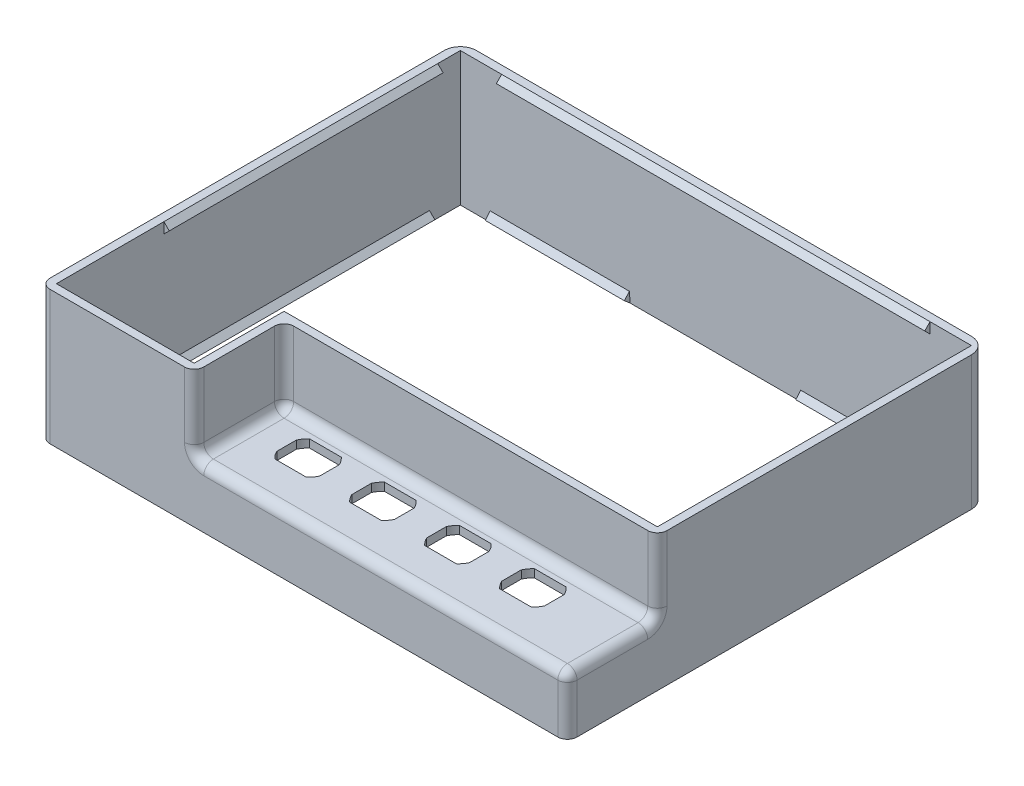
from build123d import *

# Parameters (mm, degrees)
SKETCH1_W                 = 98.44
SKETCH1_H                 = 78.44
SKETCH1_W_2               = 95.44
SKETCH1_H_2               = 75.44
BOSS_EXTRUDE1_DEPTH       = 25
SKETCH4_W                 = 98.44
SKETCH4_H                 = 16.8
BOSS_EXTRUDE2_DEPTH       = 1.5
CUT_EXTRUDE1_DEPTH        = 1.6
SKETCH5_W                 = 18
SKETCH5_H                 = 14
CUT_EXTRUDE2_DEPTH        = 70.5
BOSS_EXTRUDE9_DEPTH       = 49.22
BOSS_EXTRUDE9_DEPTH_BACK  = 22
SKETCH7_W                 = 1.5
SKETCH7_H                 = 15.5
BOSS_EXTRUDE10_START      = -56
BOSS_EXTRUDE10_DEPTH      = 64
BOSS_EXTRUDE11_DEPTH      = 42
BOSS_EXTRUDE11_DEPTH_BACK = 42
CUT_EXTRUDE3_DEPTH        = 16
CUT_EXTRUDE3_DEPTH_BACK   = 16
BOSS_EXTRUDE12_DEPTH      = 42
BOSS_EXTRUDE12_DEPTH_BACK = 42
CUT_EXTRUDE4_DEPTH        = 16
CUT_EXTRUDE4_DEPTH_BACK   = 16
BOSS_EXTRUDE13_DEPTH      = 40
BOSS_EXTRUDE13_DEPTH_BACK = 40
BOSS_EXTRUDE14_START      = -15.64
BOSS_EXTRUDE14_DEPTH      = 51.14
FILLET4_R                 = 1.8
SKETCH16_W                = 1.5
SKETCH16_H                = 14
BOSS_EXTRUDE15_DEPTH      = 16.8
SKETCH17_W                = 15.3
SKETCH17_H                = 1.5
CUT_EXTRUDE6_DEPTH        = 25.72
FILLET5_R                 = 1.8
BOSS_EXTRUDE16_DEPTH      = 53
FILLET6_R                 = 3


with BuildPart() as part:
    # Sketch1 → Boss-Extrude1 (new body)
    with BuildSketch(Plane(origin=(0, 0, 0), x_dir=(1, 0, 0), z_dir=(0, 1, 0))):
        Rectangle(SKETCH1_W, SKETCH1_H)
        Rectangle(SKETCH1_W_2, SKETCH1_H_2, mode=Mode.SUBTRACT)
    extrude(amount=BOSS_EXTRUDE1_DEPTH)

    # Sketch4 → Boss-Extrude2 (add)
    with BuildSketch(Plane(origin=(0, 11, 0), x_dir=(-1, 0, 0), z_dir=(0, -1, 0))):
        with Locations((0, -30.82)):
            Rectangle(SKETCH4_W, SKETCH4_H)
    extrude(amount=BOSS_EXTRUDE2_DEPTH)

    # Sketch3 → Cut-Extrude1 (cut)
    with BuildSketch(Plane(origin=(0, 11, 0), x_dir=(-1, 0, 0), z_dir=(0, -1, 0))):
        with BuildLine():
            Line((-34.933489157, -25.17), (-29.010238143, -25.17))
            ThreePointArc((-29.010238143, -25.17), (-28.418962197, -25.829514156), (-27.97186365, -26.594150707))
            Line((-27.97186365, -26.594150707), (-27.97186365, -30.245849293))
            ThreePointArc((-27.97186365, -30.245849293), (-28.418962197, -31.010485844), (-29.010238143, -31.67))
            Line((-29.010238143, -31.67), (-34.933489157, -31.67))
            ThreePointArc((-34.933489157, -31.67), (-35.524765103, -31.010485844), (-35.97186365, -30.245849293))
            Line((-35.97186365, -30.245849293), (-35.97186365, -26.594150707))
            ThreePointArc((-35.97186365, -26.594150707), (-35.524765103, -25.829514156), (-34.933489157, -25.17))
        make_face()
        with BuildLine():
            Line((-20.933489157, -25.17), (-15.010238143, -25.17))
            ThreePointArc((-15.010238143, -25.17), (-14.418962197, -25.829514156), (-13.97186365, -26.594150707))
            Line((-13.97186365, -26.594150707), (-13.97186365, -30.245849293))
            ThreePointArc((-13.97186365, -30.245849293), (-14.418962197, -31.010485844), (-15.010238143, -31.67))
            Line((-15.010238143, -31.67), (-20.933489157, -31.67))
            ThreePointArc((-20.933489157, -31.67), (-21.524765103, -31.010485844), (-21.97186365, -30.245849293))
            Line((-21.97186365, -30.245849293), (-21.97186365, -26.594150707))
            ThreePointArc((-21.97186365, -26.594150707), (-21.524765103, -25.829514156), (-20.933489157, -25.17))
        make_face()
        with BuildLine():
            Line((-6.933489157, -25.17), (-1.010238143, -25.17))
            ThreePointArc((-1.010238143, -25.17), (-0.418962197, -25.829514156), (0.02813635, -26.594150707))
            Line((0.02813635, -26.594150707), (0.02813635, -30.245849293))
            ThreePointArc((0.02813635, -30.245849293), (-0.418962197, -31.010485844), (-1.010238143, -31.67))
            Line((-1.010238143, -31.67), (-6.933489157, -31.67))
            ThreePointArc((-6.933489157, -31.67), (-7.524765103, -31.010485844), (-7.97186365, -30.245849293))
            Line((-7.97186365, -30.245849293), (-7.97186365, -26.594150707))
            ThreePointArc((-7.97186365, -26.594150707), (-7.524765103, -25.829514156), (-6.933489157, -25.17))
        make_face()
        with BuildLine():
            Line((7.066510843, -25.17), (12.989761857, -25.17))
            ThreePointArc((12.989761857, -25.17), (13.581037803, -25.829514156), (14.02813635, -26.594150707))
            Line((14.02813635, -26.594150707), (14.02813635, -30.245849293))
            ThreePointArc((14.02813635, -30.245849293), (13.581037803, -31.010485844), (12.989761857, -31.67))
            Line((12.989761857, -31.67), (7.066510843, -31.67))
            ThreePointArc((7.066510843, -31.67), (6.475234897, -31.010485844), (6.02813635, -30.245849293))
            Line((6.02813635, -30.245849293), (6.02813635, -26.594150707))
            ThreePointArc((6.02813635, -26.594150707), (6.475234897, -25.829514156), (7.066510843, -25.17))
        make_face()
    extrude(amount=CUT_EXTRUDE1_DEPTH, mode=Mode.SUBTRACT)

    # Sketch5 → Cut-Extrude2 (cut)
    with BuildSketch(Plane(origin=(49.22, 0, 0), x_dir=(0, 0, -1), z_dir=(1, 0, 0))):
        with Locations((-30.22, 18)):
            Rectangle(SKETCH5_W, SKETCH5_H)
    extrude(amount=-CUT_EXTRUDE2_DEPTH, mode=Mode.SUBTRACT)

    # Sketch7 → Boss-Extrude9 (add, two sides: drawn at the far end of the back side and taken through both)
    with BuildSketch(Plane(origin=(0, 0, 0), x_dir=(0, 0, -1), z_dir=(1, 0, 0)).offset(-BOSS_EXTRUDE9_DEPTH_BACK)):
        with Locations((-21.67, 17.25)):
            Rectangle(SKETCH7_W, SKETCH7_H)
    extrude(amount=BOSS_EXTRUDE9_DEPTH + BOSS_EXTRUDE9_DEPTH_BACK)

    # Sketch9 → Boss-Extrude10 (add)
    with BuildSketch(Plane.XY.offset(24.04).offset(BOSS_EXTRUDE10_START)):
        Polygon((-47.72, 2), (-46.72, 1), (-47.72, 0), align=None)
    boss_extrude10 = extrude(amount=BOSS_EXTRUDE10_DEPTH)

    # Mirror1: Boss-Extrude10 across plane
    add(boss_extrude10.mirror(Plane(origin=(0, 0, 0), x_dir=(0, 0, 1), z_dir=(1, 0, 0))))

    # Sketch12 → Boss-Extrude13 (add, two sides: drawn at the far end of the back side and taken through both)
    with BuildSketch(Plane(origin=(0, 0, 0), x_dir=(0, 0, -1), z_dir=(1, 0, 0)).offset(-BOSS_EXTRUDE13_DEPTH_BACK)):
        Polygon((36.72, 24), (37.72, 25), (37.72, 23), align=None)
    extrude(amount=BOSS_EXTRUDE13_DEPTH + BOSS_EXTRUDE13_DEPTH_BACK)

    # Sketch14 → Boss-Extrude14 (add)
    with BuildSketch(Plane.XY.offset(-17.86).offset(BOSS_EXTRUDE14_START)):
        Polygon((47.72, 25), (46.72, 24), (47.72, 23), align=None)
    boss_extrude14 = extrude(amount=BOSS_EXTRUDE14_DEPTH)

    # Mirror3: Boss-Extrude14 across plane
    add(boss_extrude14.mirror(Plane(origin=(0, 0, 0), x_dir=(0, 0, 1), z_dir=(1, 0, 0))))

    # Fillet4
    fillet4_edges = [part.edges().sort_by_distance(p)[0] for p in [
        (49.22, 5.5, 39.22),
        (49.22, 11, 30.82),
        (13.61, 11, 22.42),
        (49.22, 18, 22.42),
        (-49.22, 12.5, 39.22),
    ]]
    fillet(fillet4_edges, radius=FILLET4_R)

    # Sketch16 → Boss-Extrude15 (add)
    with BuildSketch(Plane.XY.offset(22.42)):
        with Locations((-21.25, 18)):
            Rectangle(SKETCH16_W, SKETCH16_H)
    extrude(amount=BOSS_EXTRUDE15_DEPTH)

    # Sketch17 → Cut-Extrude6 (cut)
    with BuildSketch(Plane(origin=(-47.72, 0, 0), x_dir=(0, 0, -1), z_dir=(1, 0, 0))):
        with Locations((-30.07, 10.25)):
            Rectangle(SKETCH17_W, SKETCH17_H)
    extrude(amount=CUT_EXTRUDE6_DEPTH, mode=Mode.SUBTRACT)

    # Fillet5
    # the kernel refuses this fillet: 1.8 mm, written as the material it adds along each edge
    with BuildSketch(Plane(origin=(-20.5, 12.8, 24.22), x_dir=(0, 0, -1), z_dir=(0, 1, 0))) as fillet5_piece_1:
        with BuildLine():
            CenterArc((1.8 - FILLET5_R, -FILLET5_R), FILLET5_R, 0, 90)
            Line((1.8 - FILLET5_R, 0), (1.8, 0))
            Line((1.8, 0), (1.8, -FILLET5_R))
        make_face()
    revolve(axis=Axis((-20.5, 12.8, 24.22), (-1, 0, 0)), revolution_arc=90)
    with BuildSketch(Plane(origin=(-20.5, 11, 24.22), x_dir=(1, 0, 0), z_dir=(0, 0, 1))) as fillet5_piece_2:
        with BuildLine():
            CenterArc((FILLET5_R, FILLET5_R), FILLET5_R, 180, 90)
            Line((0, FILLET5_R), (0, 0))
            Line((0, 0), (FILLET5_R, 0))
        make_face()
    extrude(amount=15)
    with BuildSketch(Plane(origin=(-20.5, 25, 22.42), x_dir=(1, 0, 0), z_dir=(0, -1, 0))) as fillet5_piece_3:
        with BuildLine():
            CenterArc((FILLET5_R, FILLET5_R), FILLET5_R, 180, 90)
            Line((0, FILLET5_R), (0, 0))
            Line((0, 0), (FILLET5_R, 0))
        make_face()
    extrude(amount=12.2)
    # the kernel refuses this fillet: 1.8 mm, written as the material it takes off along each edge
    with BuildSketch(Plane(origin=(47.42, 9.2, 37.42), x_dir=(0, 1, 0), z_dir=(0, 0, 1))) as fillet5_2_piece_1_section:
        Polygon((0, 0), (FILLET5_R, 0), (FILLET5_R, -FILLET5_R), (0, -FILLET5_R), align=None)
    fillet5_2_piece_1 = extrude(amount=FILLET5_R, mode=Mode.PRIVATE)
    fillet5_2_piece_1 = fillet5_2_piece_1 - Plane(origin=(47.42, 9.2, 37.42), x_dir=(-0.7071067811865475, -0.7071067811865475, 0), z_dir=(0, 0, 1)) * Sphere(FILLET5_R, mode=Mode.PRIVATE)
    add(fillet5_2_piece_1, mode=Mode.SUBTRACT)
    with BuildSketch(Plane(origin=(47.42, 11, 39.22), x_dir=(0, -1, 0), z_dir=(-1, 0, 0))) as fillet5_2_piece_2:
        with BuildLine():
            CenterArc((FILLET5_R, -FILLET5_R), FILLET5_R, 90, 90)
            Line((0, -FILLET5_R), (0, 0))
            Line((0, 0), (FILLET5_R, 0))
        make_face()
    extrude(amount=66.12, mode=Mode.SUBTRACT)
    with BuildSketch(Plane(origin=(-20.5, 29.5, 39.22), x_dir=(-1, 0, 0), z_dir=(0, -1, 0))) as fillet5_2_piece_3:
        with BuildLine():
            CenterArc((FILLET5_R, FILLET5_R), FILLET5_R, 180, 90)
            Line((0, FILLET5_R), (0, 0))
            Line((0, 0), (FILLET5_R, 0))
        make_face()
    extrude(amount=16.7, mode=Mode.SUBTRACT)
    with BuildSketch(Plane(origin=(-18.7, 12.8, 39.22), x_dir=(0, -1, 0), z_dir=(1, 0, 0))) as fillet5_2_piece_4:
        with BuildLine():
            CenterArc((1.8 + FILLET5_R, FILLET5_R), FILLET5_R, 180, 90)
            Line((1.8, FILLET5_R), (1.8, 0))
            Line((1.8, 0), (1.8 + FILLET5_R, 0))
        make_face()
    revolve(axis=Axis((-18.7, 12.8, 39.22), (0, 0, -1)), revolution_arc=90, mode=Mode.SUBTRACT)

    # Sketch19 → Boss-Extrude16 (add)
    with BuildSketch(Plane.ZY.offset(-40.72)):
        Polygon((20.92, 25), (19.92, 24), (20.92, 23), align=None)
    extrude(amount=BOSS_EXTRUDE16_DEPTH)

    # Fillet6
    fillet6_edges = [part.edges().sort_by_distance(p)[0] for p in [
        (-49.22, 12.5, -39.22),
        (49.22, 12.5, -39.22),
    ]]
    fillet(fillet6_edges, radius=FILLET6_R)


with BuildPart() as body_2:
    # Sketch10 → Boss-Extrude11 (new, two sides: drawn at the far end of the back side and taken through both)
    with BuildSketch(Plane(origin=(0, 0, 0), x_dir=(0, 0, -1), z_dir=(1, 0, 0)).offset(-BOSS_EXTRUDE11_DEPTH_BACK)):
        Polygon((-37.72, 0), (-36.560859755, -0.810181394), (-35.75067836, 0.348958851), align=None)
    extrude(amount=BOSS_EXTRUDE11_DEPTH + BOSS_EXTRUDE11_DEPTH_BACK)

    # Sketch10<2> → Cut-Extrude3 (cut, two sides: drawn at the far end of the back side and taken through both)
    with BuildSketch(Plane(origin=(0, 0, 0), x_dir=(0, 0, -1), z_dir=(1, 0, 0)).offset(-CUT_EXTRUDE3_DEPTH_BACK)):
        Polygon((-37.72, 0), (-36.560859755, -0.810181394), (-35.75067836, 0.348958851), align=None)
    extrude(amount=CUT_EXTRUDE3_DEPTH + CUT_EXTRUDE3_DEPTH_BACK, mode=Mode.SUBTRACT)


with BuildPart() as cut_extrude3_piece_1:
    # of the separate pieces the step leaves, piece 1, a body of its own (cut_extrude3_pieces)
    add(body_2.part.solids().sort_by_distance((-16, 0, 37.72))[0])


with BuildPart() as cut_extrude3_piece_2:
    # of the separate pieces the step leaves, piece 2, a body of its own (cut_extrude3_pieces)
    add(body_2.part.solids().sort_by_distance((42, 0, 37.72))[0])


with BuildPart() as body_4:
    # Sketch11 → Boss-Extrude12 (new, two sides: drawn at the far end of the back side and taken through both)
    with BuildSketch(Plane(origin=(0, 0, 0), x_dir=(0, 0, -1), z_dir=(1, 0, 0)).offset(-BOSS_EXTRUDE12_DEPTH_BACK)):
        Polygon((37.559012834, 2), (36.639506417, 0.919506417), (37.72, 0), align=None)
    extrude(amount=BOSS_EXTRUDE12_DEPTH + BOSS_EXTRUDE12_DEPTH_BACK)

    # Sketch11<2> → Cut-Extrude4 (cut, two sides: drawn at the far end of the back side and taken through both)
    with BuildSketch(Plane(origin=(0, 0, 0), x_dir=(0, 0, -1), z_dir=(1, 0, 0)).offset(-CUT_EXTRUDE4_DEPTH_BACK)):
        Polygon((37.559012834, 2), (36.639506417, 0.919506417), (37.72, 0), align=None)
    extrude(amount=CUT_EXTRUDE4_DEPTH + CUT_EXTRUDE4_DEPTH_BACK, mode=Mode.SUBTRACT)


with BuildPart() as cut_extrude4_piece_1:
    # of the separate pieces the step leaves, piece 1, a body of its own (cut_extrude4_pieces)
    add(body_4.part.solids().sort_by_distance((42, 2, -37.559012834))[0])


with BuildPart() as cut_extrude4_piece_2:
    # of the separate pieces the step leaves, piece 2, a body of its own (cut_extrude4_pieces)
    add(body_4.part.solids().sort_by_distance((-16, 2, -37.559012834))[0])


solid = Compound([part.part, cut_extrude3_piece_1.part, cut_extrude3_piece_2.part, cut_extrude4_piece_1.part, cut_extrude4_piece_2.part])
